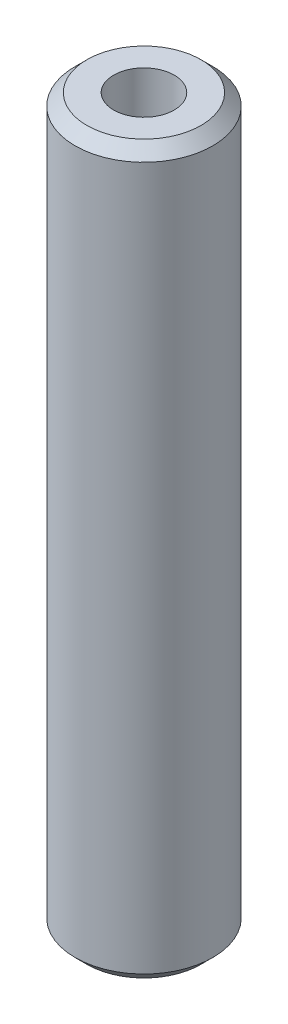
from build123d import *

# Parameters (mm, degrees)
SKETCH1_R           = 5
BOSS_EXTRUDE1_DEPTH = 52.79828958
SKETCH2_R           = 2.20039889
CUT_EXTRUDE1_DEPTH  = 54.269685399
CHAMFER1_SIZE       = 0.854781326


with BuildPart() as part:
    # Sketch1 → Boss-Extrude1 (new body)
    with BuildSketch(Plane(origin=(0, 0, 0), x_dir=(1, 0, 0), z_dir=(0, 1, 0))):
        Circle(SKETCH1_R)
    extrude(amount=BOSS_EXTRUDE1_DEPTH)

    # Sketch2 → Cut-Extrude1 (cut, through all)
    with BuildSketch(Plane(origin=(0, 0, 0), x_dir=(1, 0, 0), z_dir=(0, 1, 0))):
        Circle(SKETCH2_R)
    extrude(amount=CUT_EXTRUDE1_DEPTH, mode=Mode.SUBTRACT)

    # Chamfer1
    chamfer1_edges = [part.edges().sort_by_distance(p)[0] for p in [
        (-5, 52.79828958, 0),
        (-5, 0, 0),
    ]]
    chamfer(chamfer1_edges, length=CHAMFER1_SIZE)


solid = part.part
